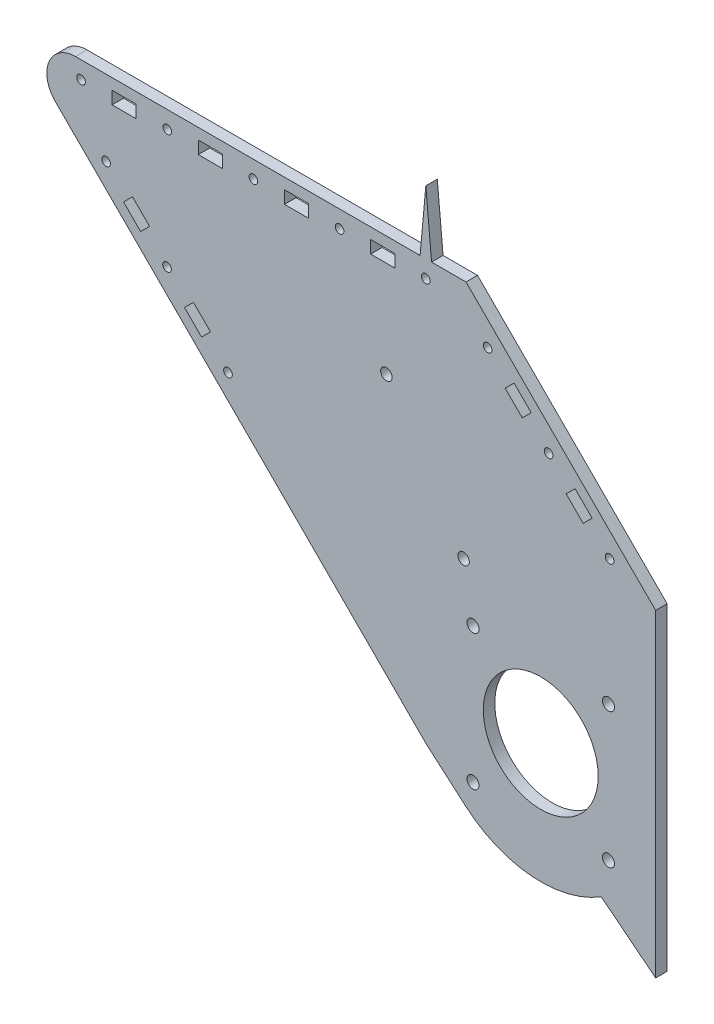
from build123d import *

# Parameters (mm, degrees)
SKETCH_1_R      = 1.5
SKETCH_1_R_2    = 20
SKETCH_1_R_3    = 2.1
SKETCH_1_R_4    = 2
SKETCH_1_W      = 8.4
SKETCH_1_H      = 4.4
EXTRUDE_1_DEPTH = 4
EXTRUDE_2_DEPTH = 4
EXTRUDE_4_DEPTH = 4


with BuildPart() as part:
    # 草图1 → 凸台-拉伸1 (new body)
    with BuildSketch(Plane.XY):
        with BuildLine():
            Line((7.027428163, -5.002489357), (20.810808237, -16.960441938))
            ThreePointArc((20.810808237, -16.960441938), (47.017847244, -26.746287876), (73.227648339, -16.967842153))
            Line((73.227648339, -16.967842153), (87.027428163, -5.002489357))
            Line((87.027428163, -5.002489357), (87.027428163, 75.054738201))
            Line((87.027428163, 75.054738201), (21.027428163, 141.054738201))
            Line((21.027428163, 141.054738201), (-114.887663771, 141.054738201))
            ThreePointArc((-114.887663771, 141.054738201), (-124.126459096, 134.881572525), (-121.958731583, 123.983670389))
            Line((-121.958731583, 123.983670389), (-90.203942848, 92.228881654))
            Line((-90.203942848, 92.228881654), (7.027428163, -5.002489357))
        make_face()
        with Locations((-52.972571837, 135.054738201)):
            Circle(SKETCH_1_R, mode=Mode.SUBTRACT)
        with Locations((47.027428163, 15.054738201)):
            Circle(SKETCH_1_R_2, mode=Mode.SUBTRACT)
        with Locations((-22.972571837, 135.054738201)):
            Circle(SKETCH_1_R, mode=Mode.SUBTRACT)
        with Locations((7.027428163, 135.054738201)):
            Circle(SKETCH_1_R, mode=Mode.SUBTRACT)
        with Locations((-112.972571837, 135.054738201)):
            Circle(SKETCH_1_R, mode=Mode.SUBTRACT)
        with Locations((-82.972571837, 135.054738201)):
            Circle(SKETCH_1_R, mode=Mode.SUBTRACT)
        with Locations((49.784787476, 103.812097514)):
            Circle(SKETCH_1_R, mode=Mode.SUBTRACT)
        with Locations((70.997990912, 82.598894078)):
            Circle(SKETCH_1_R, mode=Mode.SUBTRACT)
        with Locations((28.571584041, 125.025300949)):
            Circle(SKETCH_1_R, mode=Mode.SUBTRACT)
        with Locations((70.597428163, 38.624738201)):
            Circle(SKETCH_1_R_3, mode=Mode.SUBTRACT)
        with Locations((70.597428163, -8.515261799)):
            Circle(SKETCH_1_R_3, mode=Mode.SUBTRACT)
        with Locations((23.457428163, -8.515261799)):
            Circle(SKETCH_1_R_3, mode=Mode.SUBTRACT)
        with Locations((23.457428163, 38.624738201)):
            Circle(SKETCH_1_R_3, mode=Mode.SUBTRACT)
        with Locations((-83.04451802, 93.554738201)):
            Circle(SKETCH_1_R, mode=Mode.SUBTRACT)
        with Locations((-61.831314585, 72.341534765)):
            Circle(SKETCH_1_R, mode=Mode.SUBTRACT)
        with Locations((-104.257721456, 114.767941637)):
            Circle(SKETCH_1_R, mode=Mode.SUBTRACT)
        with Locations((20.166275086, 57.226748532)):
            Circle(SKETCH_1_R_4, mode=Mode.SUBTRACT)
        with Locations((-6.694877991, 99.398758863)):
            Circle(SKETCH_1_R_4, mode=Mode.SUBTRACT)
        with Locations((-37.972571837, 135.054738201)):
            Rectangle(SKETCH_1_W, SKETCH_1_H, mode=Mode.SUBTRACT)
        with Locations((-7.972571837, 135.054738201)):
            Rectangle(SKETCH_1_W, SKETCH_1_H, mode=Mode.SUBTRACT)
        with Locations((-97.972571837, 135.054738201)):
            Rectangle(SKETCH_1_W, SKETCH_1_H, mode=Mode.SUBTRACT)
        with Locations((-67.972571837, 135.054738201)):
            Rectangle(SKETCH_1_W, SKETCH_1_H, mode=Mode.SUBTRACT)
        Polygon((55.865905794, 94.619709358), (61.805602756, 88.680012396), (64.916872594, 91.791282234), (58.977175632, 97.730979196), align=None, mode=Mode.SUBTRACT)
        Polygon((34.652702359, 115.832912794), (37.763972196, 118.944182631), (43.703669158, 113.004485669), (40.592399321, 109.893215832), align=None, mode=Mode.SUBTRACT)
        Polygon((-73.852129865, 87.473619883), (-76.963399702, 84.362350046), (-71.02370274, 78.422653084), (-67.912432903, 81.533922921), align=None, mode=Mode.SUBTRACT)
        Polygon((-89.125636339, 102.747126356), (-92.236906176, 99.635856519), (-98.176603138, 105.575553481), (-95.065333301, 108.686823318), align=None, mode=Mode.SUBTRACT)
    extrude(amount=EXTRUDE_1_DEPTH)

    # 草图2 → 凸台-拉伸2 (add)
    with BuildSketch(Plane.XY.offset(4)):
        Polygon((87.027428163, -5.002489357), (87.027428163, -35.754116483), (68.089633724, -20.749490711), align=None)
    extrude(amount=-EXTRUDE_2_DEPTH)

    # 草图3 → 凸台-拉伸4 (add)
    with BuildSketch(Plane.XY.offset(4)):
        Polygon((7.027428163, 141.054738201), (5.027428163, 141.054738201), (7.027428163, 163.054738201), (9.027428163, 141.054738201), align=None)
    extrude(amount=-EXTRUDE_4_DEPTH)


solid = part.part
